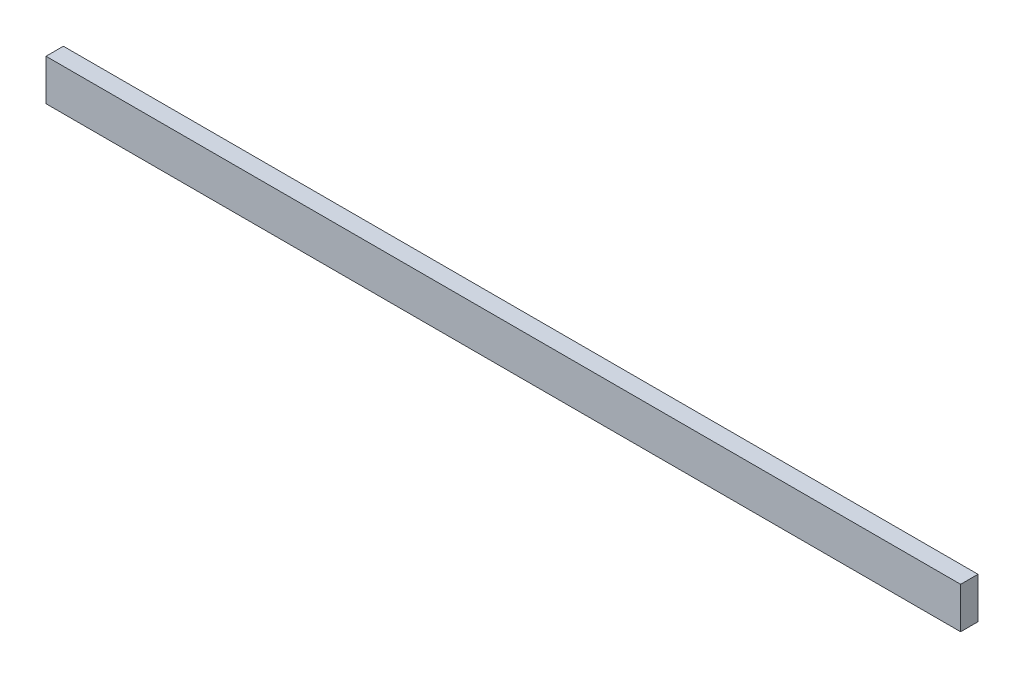
from build123d import *

# Parameters (mm, degrees)
SKETCH1_W           = 1000.5
SKETCH1_H           = 19
BOSS_EXTRUDE1_DEPTH = 45


with BuildPart() as part:
    # Sketch1 → Boss-Extrude1 (new body)
    with BuildSketch(Plane(origin=(0, 0, 0), x_dir=(1, 0, 0), z_dir=(0, 1, 0))):
        with Locations((500.25, 0)):
            Rectangle(SKETCH1_W, SKETCH1_H)
    extrude(amount=BOSS_EXTRUDE1_DEPTH)


solid = part.part
